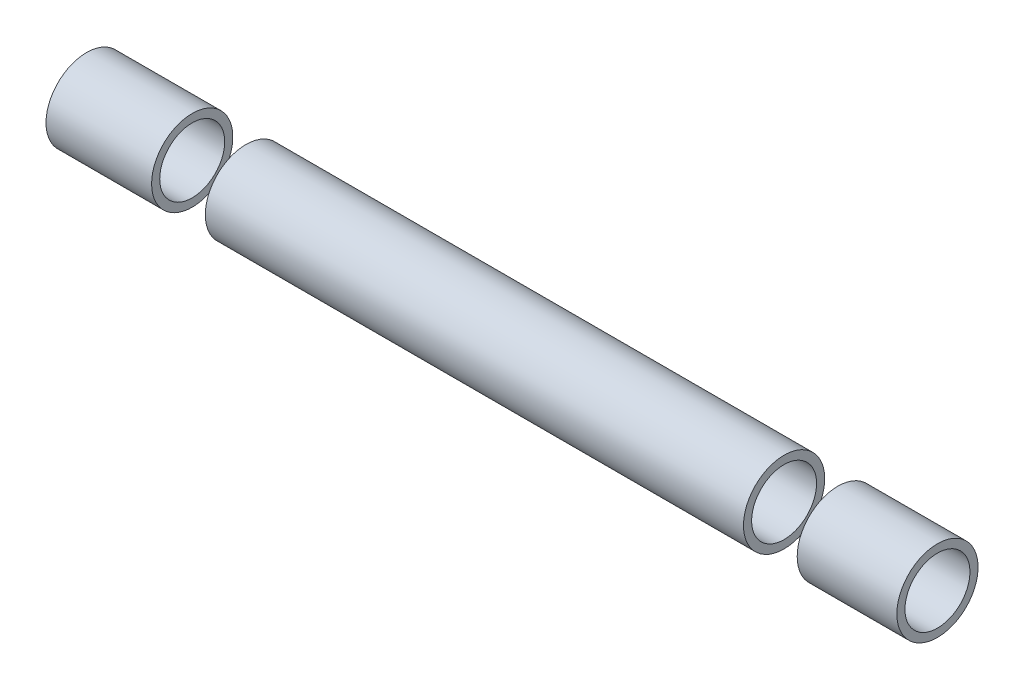
from build123d import *

# Parameters (mm, degrees)
SKETCH1_R               = 15.875
SKETCH1_R_2             = 12.7
EXTRUDE_THIN1_DEPTH     = 167.4495
CUT_EXTRUDE1_DEPTH      = 169.947821236
CUT_EXTRUDE1_DEPTH_BACK = 169.947821236
SKETCH2_W               = 20.99999991
SKETCH2_H               = 31.75
SKETCH2_W_2             = 2.3241


with BuildPart() as part:
    # Sketch1 → Extrude-Thin1 (new, symmetric)
    with BuildSketch(Plane(origin=(0, 0, 0), x_dir=(0, 0, -1), z_dir=(1, 0, 0))):
        Circle(SKETCH1_R)
        Circle(SKETCH1_R_2, mode=Mode.SUBTRACT)
    extrude(amount=EXTRUDE_THIN1_DEPTH, both=True)

    # Sketch2 → Cut-Extrude1 (cut, two sides: drawn at the far end of the back side and taken through both)
    with BuildSketch(Plane.XY.offset(-CUT_EXTRUDE1_DEPTH_BACK)):
        with Locations((115.674500045, 0)):
            Rectangle(SKETCH2_W, SKETCH2_H)
        with Locations((-115.674500045, 0)):
            Rectangle(SKETCH2_W, SKETCH2_H)
        with Locations((166.28745, 0)):
            Rectangle(SKETCH2_W_2, SKETCH2_H)
    extrude(amount=CUT_EXTRUDE1_DEPTH + CUT_EXTRUDE1_DEPTH_BACK, mode=Mode.SUBTRACT)


with BuildPart() as cut_extrude1_piece_1:
    # of the separate pieces the step leaves, piece 1, a body of its own (cut_extrude1_pieces)
    add(part.part.solids().sort_by_distance((-105.17450009, 0, -15.875))[0])


with BuildPart() as cut_extrude1_piece_2:
    # of the separate pieces the step leaves, piece 2, a body of its own (cut_extrude1_pieces)
    add(part.part.solids().sort_by_distance((-167.4495, 0, -15.875))[0])


with BuildPart() as cut_extrude1_piece_3:
    # of the separate pieces the step leaves, piece 3, a body of its own (cut_extrude1_pieces)
    add(part.part.solids().sort_by_distance((126.1745, 0, -15.875))[0])


solid = Compound([cut_extrude1_piece_1.part, cut_extrude1_piece_2.part, cut_extrude1_piece_3.part])
